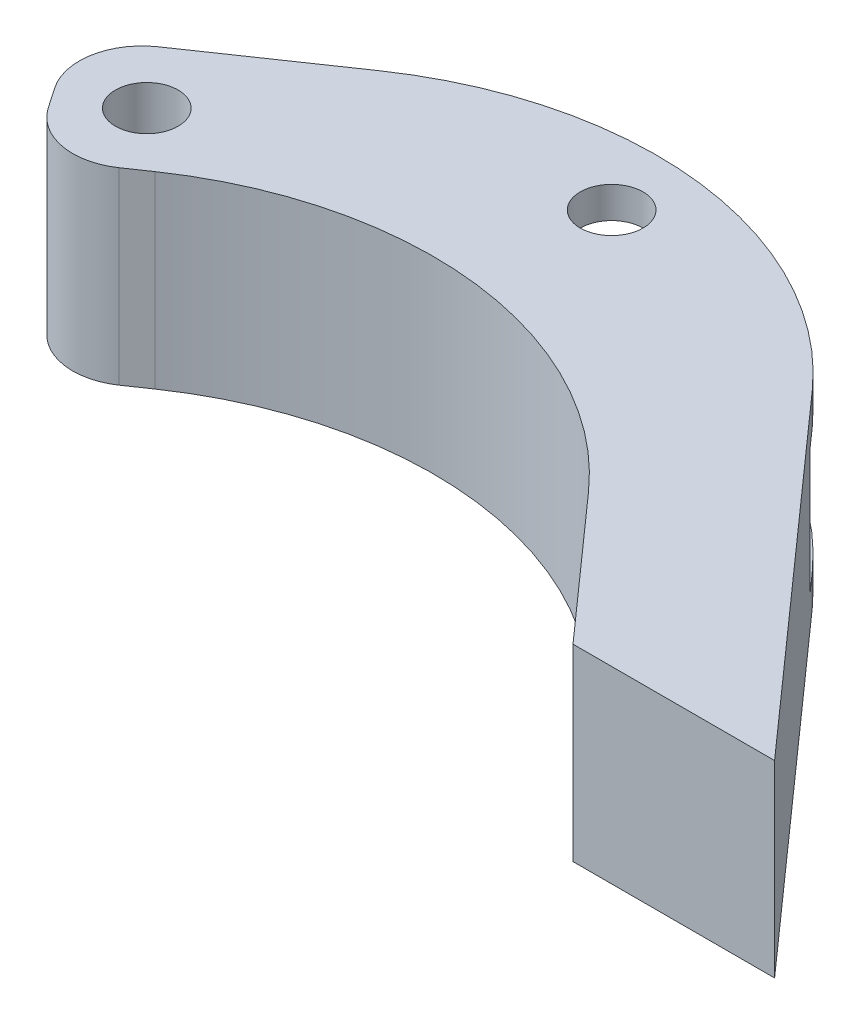
from build123d import *

# Parameters (mm, degrees)
SKETCH3_R           = 2.5
BOSS_EXTRUDE2_DEPTH = 7.5
CUT_EXTRUDE2_DEPTH  = 5
FILLET1_START       = -5
FILLET1_DEPTH       = 10
FILLET2_R           = 5


with BuildPart() as part:
    # Sketch3 → Boss-Extrude2 (new, symmetric)
    with BuildSketch(Plane(origin=(0, 0, 0), x_dir=(1, 0, 0), z_dir=(0, 1, 0))):
        with BuildLine():
            Line((0, 0), (16.055459438, 0))
            Line((16.055459438, 0), (-7.935861068, 26.99023557))
            ThreePointArc((-7.935861068, 26.99023557), (-26.707018244, 36.836313291), (-47.300903293, 31.817001905))
            Line((-47.300903293, 31.817001905), (-61.838574124, 21.868238869))
            Line((-61.838574124, 21.868238869), (-55.061469058, 11.965166269))
            Line((-55.061469058, 11.965166269), (-49.247161684, 15.944150727))
            ThreePointArc((-49.247161684, 15.944150727), (-28.653276634, 20.963462112), (-9.882119459, 11.117384391))
            Line((-9.882119459, 11.117384391), (0, 0))
        make_face()
        with Locations(Location((-53.944540562, 20, 0), (0, 0, 270))):
            Circle(SKETCH3_R, mode=Mode.SUBTRACT)
        with Locations(Location((-28.408134096, 31.487077096, 0), (0, 0, 270))):
            Circle(SKETCH3_R, mode=Mode.SUBTRACT)
    extrude(amount=BOSS_EXTRUDE2_DEPTH, both=True)

    # Sketch6 → Cut-Extrude2 (cut, symmetric)
    with BuildSketch(Plane(origin=(0, 0, 0), x_dir=(1, 0, 0), z_dir=(0, 1, 0))):
        with BuildLine():
            add(Edge.make_bspline(
                [(-14.79224673, 32.705040265), (-17.331871812, 26.215966366), (-31.296858097, 23.259335294), (-41.248027481, 30.965132279), (-47.300903293, 31.817001905)],
                knots=[0, 0, 0, 0, 0.502708052, 1, 1, 1, 1], degree=3))
            ThreePointArc((-14.79224673, 32.705040265), (-31.177344469, 37.048133404), (-47.300903293, 31.817001905))
        make_face()
    extrude(amount=CUT_EXTRUDE2_DEPTH, both=True, mode=Mode.SUBTRACT)

    # Fillet1: read off the stored shape, not the designer's step
    # Fillet1 outline → Fillet1 (cut)
    with BuildSketch(Plane(origin=(0, 0, 0), x_dir=(1, 0, 0), z_dir=(0, 1, 0)).offset(FILLET1_START)):
        with BuildLine():
            ThreePointArc((-19.221952817, 27.410351809), (-12.561308079, 28.72495355), (-6.596181971, 25.483096586))
            Line((-6.596181971, 25.483096586), (-7.935861068, 26.99023557))
            ThreePointArc((-7.935861068, 26.99023557), (-11.150327664, 30.10405779), (-14.79224673, 32.705040265))
            add(Edge.make_bspline(
                [(-14.79224673, 32.705040265), (-15.739998483, 30.283410709), (-17.311764452, 28.558502186), (-19.221952817, 27.410351809)],
                knots=[0, 0, 0, 0, 0.187603454, 0.187603454, 0.187603454, 0.187603454], degree=3))
        make_face()
        with BuildLine():
            ThreePointArc((-51.091167548, 29.223158548), (-46.575226496, 30.906360534), (-41.796439127, 30.281793648))
            add(Edge.make_bspline(
                [(-41.796439127, 30.281793648), (-43.564588599, 30.974367456), (-45.376964166, 31.546230564), (-47.300903293, 31.817001905)],
                knots=[0.84193308, 0.84193308, 0.84193308, 0.84193308, 1, 1, 1, 1], degree=3))
            Line((-47.300903293, 31.817001905), (-51.091167548, 29.223158548))
        make_face()
    extrude(amount=FILLET1_DEPTH, mode=Mode.SUBTRACT)

    # Fillet2
    fillet2_edges = [part.edges().sort_by_distance(p)[0] for p in [
        (-55.061469058, 0, -11.965166269),
        (-61.838574124, 0, -21.868238869),
    ]]
    fillet(fillet2_edges, radius=FILLET2_R)


solid = part.part
